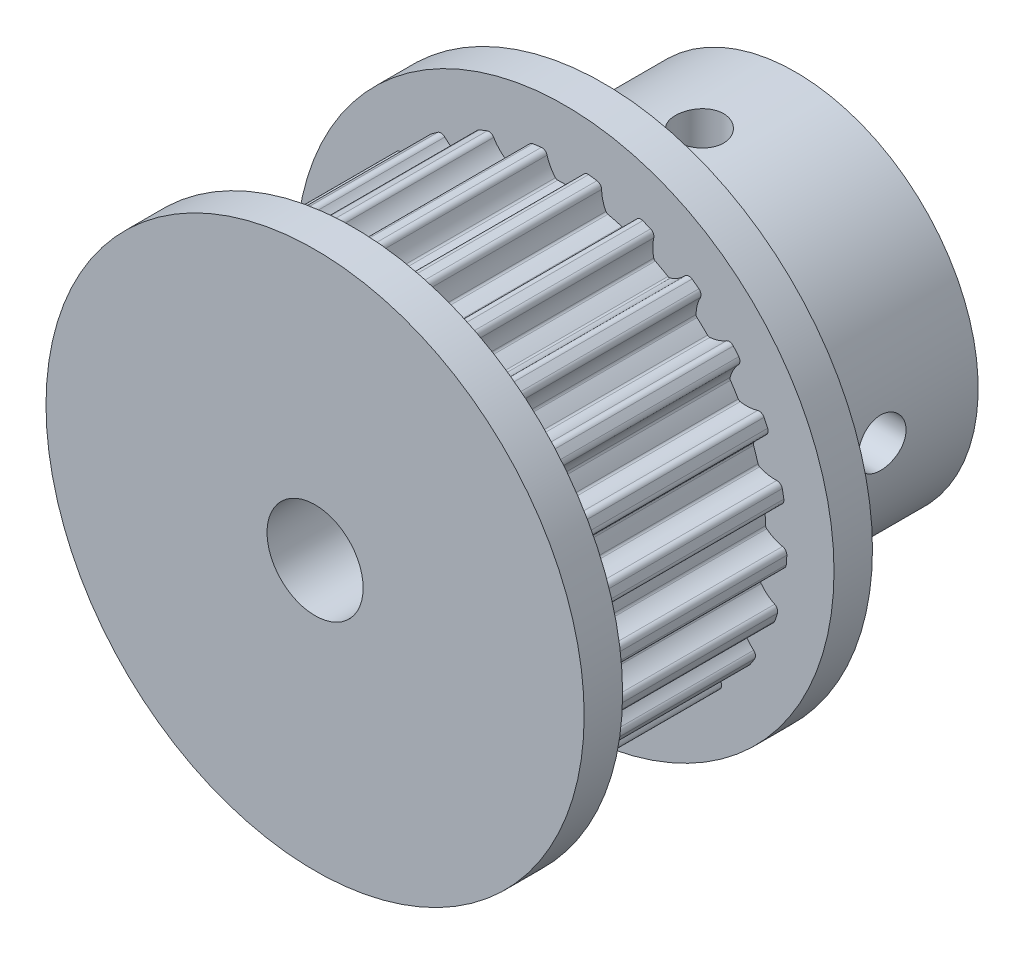
from build123d import *

# Parameters (mm, degrees)
SKETCH_1_R               = 11.555
EXTRUDE_1_DEPTH          = 5.5
CUT_EXTRUDE_1_DEPTH      = 20.698630663
PATTERN_CIRCULAR_1_COUNT = 25
SKETCH_3_R               = 14
EXTRUDE_2_DEPTH          = 2
SKETCH_5_R               = 9.5
EXTRUDE_3_DEPTH          = 10
SKETCH_4_R               = 2.5
CUT_EXTRUDE_2_DEPTH      = 32.890437438
SKETCH_7_W               = 1.25
SKETCH_7_H               = 14
PATTERN_CIRCULAR_2_COUNT = 2
PATTERN_CIRCULAR_2_ANGLE = 90


with BuildPart() as part:
    # 草圖1 → 填料-伸長1 (new, symmetric)
    with BuildSketch(Plane.XY):
        Circle(SKETCH_1_R)
    extrude(amount=EXTRUDE_1_DEPTH, both=True)

    # 草圖2 → 除料-伸長1 (cut, symmetric)
    with BuildSketch(Plane.XY.offset(5.5)):
        with BuildLine():
            Line((-63.579258929, 4.819686866), (-1.229056114, 11.489449337))
            ThreePointArc((-1.229056114, 11.489449337), (-1.041654025, 11.442459526), (-0.929297371, 11.28528584))
            ThreePointArc((-0.929297371, 11.28528584), (-0.757654953, 10.86109082), (-0.492996072, 10.487783692))
            ThreePointArc((-0.492996072, 10.487783692), (-0.440050692, 10.450027343), (-0.376101529, 10.438226508))
            ThreePointArc((-0.376101529, 10.438226508), (0, 10.445), (0.376101529, 10.438226508))
            ThreePointArc((0.376101529, 10.438226508), (0.440050692, 10.450027343), (0.492996072, 10.487783692))
            ThreePointArc((0.492996072, 10.487783692), (0.757654953, 10.86109082), (0.929297371, 11.28528584))
            ThreePointArc((0.929297371, 11.28528584), (1.041654025, 11.442459526), (1.229056114, 11.489449337))
            Line((1.229056114, 11.489449337), (63.579258929, 4.819686866))
            Line((63.579258929, 4.819686866), (63.579258929, 130.231544717))
            Line((63.579258929, 130.231544717), (-63.579258929, 130.231544717))
            Line((-63.579258929, 130.231544717), (-63.579258929, 4.819686866))
        make_face()
    cut_extrude_1 = extrude(amount=CUT_EXTRUDE_1_DEPTH, both=True, mode=Mode.SUBTRACT)

    # 環狀複製排列1: 除料-伸長1 ×25 about axis
    pattern_circular_1_axis = Axis((0, 0, 5.5), (0, 0, 1))
    for i in range(1, PATTERN_CIRCULAR_1_COUNT):
        add(cut_extrude_1.rotate(pattern_circular_1_axis, i * 360 / PATTERN_CIRCULAR_1_COUNT), mode=Mode.SUBTRACT)

    # 草圖3 → 填料-伸長2 (add)
    with BuildSketch(Plane.XY.offset(5.5)):
        Circle(SKETCH_3_R)
    extrude_2 = extrude(amount=EXTRUDE_2_DEPTH)

    # 鏡射1: 填料-伸長2 across plane
    add(extrude_2.mirror(Plane.XY))

    # 草圖5 → 填料-伸長3 (add)
    with BuildSketch(Plane(origin=(0, 0, -7.5), x_dir=(-1, 0, 0), z_dir=(0, 0, -1))):
        Circle(SKETCH_5_R)
    extrude(amount=EXTRUDE_3_DEPTH)

    # 草圖4 → 除料-伸長2 (cut, through all)
    with BuildSketch(Plane.XY.offset(7.5)):
        Circle(SKETCH_4_R)
    extrude(amount=-CUT_EXTRUDE_2_DEPTH, mode=Mode.SUBTRACT)

    # 草圖7 → M3x0.5 螺紋孔1 (revolve, cut)
    with BuildSketch(Plane(origin=(0, 0, -12.5), x_dir=(0, 0, -1), z_dir=(1, 0, 0))):
        with Locations((0.625, 7)):
            Rectangle(SKETCH_7_W, SKETCH_7_H)
    m3x0_5_1 = revolve(axis=Axis((0, -6.35, -12.5), (0, 1, 0)), mode=Mode.SUBTRACT)

    # 環狀複製排列2: M3x0.5 螺紋孔1 ×2 about axis
    pattern_circular_2_axis = Axis((0, 0, -17.5), (0, 0, -1))
    for i in range(1, PATTERN_CIRCULAR_2_COUNT):
        add(m3x0_5_1.rotate(pattern_circular_2_axis, i * PATTERN_CIRCULAR_2_ANGLE / (PATTERN_CIRCULAR_2_COUNT - 1)), mode=Mode.SUBTRACT)


solid = part.part
